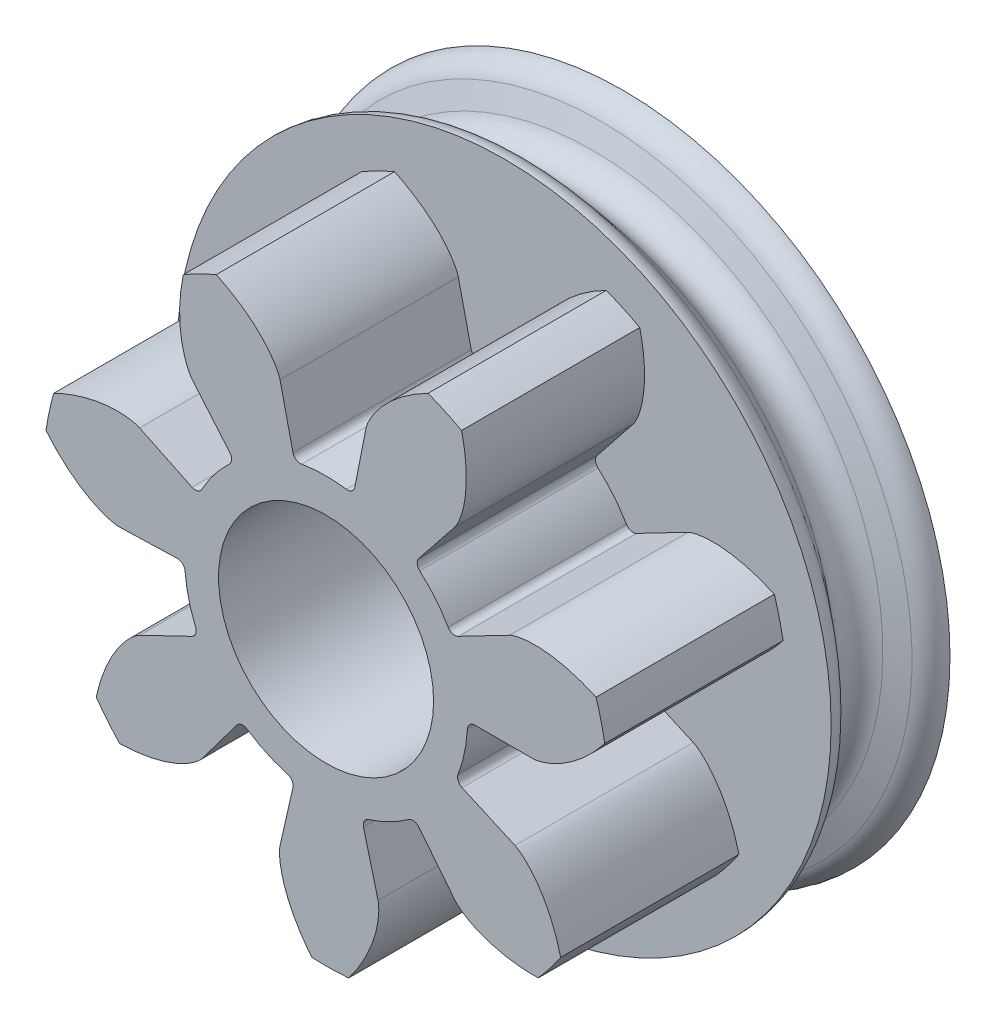
from build123d import *

# Parameters (mm, degrees)
SKETCH2_R                = 9.525
BOSS_EXTRUDE1_DEPTH      = 6
CUT_EXTRUDE1_DEPTH       = 6
FILLET1_R                = 0.254
CIRPATTERN3_COUNT        = 7
FILLET1_OF_CIRPATTERN3_R = 0.254
SKETCH5_R                = 3.6195
CUT_EXTRUDE2_DEPTH       = 19.493242128


# Read off the part's stored shape, not the designer's step: Cut-Extrude1
with BuildPart() as part:
    # Sketch2 → Boss-Extrude1 (new body)
    with BuildSketch(Plane.XY):
        Circle(SKETCH2_R)
    extrude(amount=BOSS_EXTRUDE1_DEPTH)

    # Cut-Extrude1 outline → Cut-Extrude1 (cut)
    with BuildSketch(Plane.XY):
        with BuildLine():
            add(Edge.make_bspline(
                [(7.897843079, -5.324443605), (7.889143341, -5.289999139), (7.867227424, -5.205648747), (7.827727113, -5.060059729), (7.771666127, -4.883663277), (7.701398596, -4.679948485), (7.625552695, -4.488360923), (7.541233, -4.294097512), (7.449800697, -4.106928499), (7.349957655, -3.921669386), (7.243971635, -3.745871788), (7.144005576, -3.596252965), (7.053247562, -3.472826422), (6.97418145, -3.373120571), (6.906540088, -3.293141366), (6.83627385, -3.215340389), (6.763281904, -3.140161429), (6.687469161, -3.067922243), (6.615142647, -3.004844734), (6.547015129, -2.950588631), (6.487230743, -2.907407915), (6.439655955, -2.876083449), (6.401232447, -2.853389362), (6.377134376, -2.840501757), (6.364085781, -2.83432127), (6.359383216, -2.832226927)],
                knots=[0.125661341, 0.125661341, 0.125661341, 0.125661341, 0.125661341, 0.164197228, 0.218929529, 0.273661934, 0.328394301, 0.383126635, 0.43785898, 0.492591256, 0.547323565, 0.602055884, 0.652783571, 0.680149903, 0.707515961, 0.734882063, 0.762248421, 0.789614741, 0.816980391, 0.844236067, 0.862480777, 0.880559096, 0.894007228, 0.903714168, 0.909090916, 0.909090916, 0.909090916, 0.909090916, 0.909090916], degree=4))
            ThreePointArc((7.897843079, -5.324443605), (9.316745812, -1.980876693), (9.380868546, 1.6507363))
            add(Edge.make_bspline(
                [(6.961556166, 0), (6.966704019, 0), (6.981138372, 0.000337209), (7.008395135, 0.002306025), (7.052727841, 0.007404928), (7.10893141, 0.016664594), (7.181112025, 0.031787617), (7.265419984, 0.053633703), (7.357152611, 0.081829835), (7.45579723, 0.116976829), (7.553061062, 0.155956916), (7.648901697, 0.198441138), (7.743230692, 0.24398307), (7.856021752, 0.302897275), (7.989143851, 0.378723625), (8.141333522, 0.474730445), (8.309672953, 0.592202432), (8.476250078, 0.720816713), (8.635921012, 0.854597498), (8.791980848, 0.997752698), (8.939211234, 1.141910972), (9.086279598, 1.299416968), (9.209256135, 1.437747419), (9.304570852, 1.554672786), (9.358908009, 1.622810658), (9.380868546, 1.6507363)],
                knots=[0, 0, 0, 0, 0, 0.005376748, 0.015083688, 0.02853182, 0.046610139, 0.064854849, 0.092110525, 0.119476175, 0.146842495, 0.174208853, 0.201574955, 0.228941013, 0.256307345, 0.307035032, 0.361767351, 0.41649966, 0.471231936, 0.525964281, 0.580696615, 0.635428982, 0.690161387, 0.744893688, 0.783429575, 0.783429575, 0.783429575, 0.783429575, 0.783429575], degree=4))
            Line((6.961556166, 0), (4.7625, 0))
            ThreePointArc((4.7625, 0), (4.658372906, -0.990438347), (4.350544885, -1.937566891))
            Line((4.350544885, -1.937566891), (6.359383216, -2.832226927))
        make_face()
    cut_extrude1 = extrude(amount=CUT_EXTRUDE1_DEPTH, mode=Mode.SUBTRACT)

    # Fillet1
    fillet1_edges = [part.edges().sort_by_distance(p)[0] for p in [
        (4.350544885, -1.937566891, 3),
        (4.7625, 0, 3),
    ]]
    fillet(fillet1_edges, radius=FILLET1_R)

    # CirPattern3: Cut-Extrude1 ×7 about axis
    cirpattern3_axis = Axis((0, 0, 55), (0, 0, -1))
    for i in range(1, CIRPATTERN3_COUNT):
        add(cut_extrude1.rotate(cirpattern3_axis, i * 360 / CIRPATTERN3_COUNT), mode=Mode.SUBTRACT)

    # Fillet1 of CirPattern3
    fillet1_of_cirpattern3_edges = [part.edges().sort_by_distance(p)[0] for p in [
        (1.197669574, -4.609446154, 3),
        (2.969370181, -3.723472435, 3),
        (-2.857075355, -3.810318447, 3),
        (-1.059755948, -4.643094182, 3),
        (-4.760384267, -0.141943234, 3),
        (-4.290864233, -2.066371308, 3),
        (-3.079026732, 3.63331813, 3),
        (-4.290864233, 2.066371308, 3),
        (0.920900733, 4.672616836, 3),
        (-1.059755948, 4.643094182, 3),
        (4.227371163, 2.19333976, 3),
        (2.969370181, 3.723472435, 3),
    ]]
    fillet(fillet1_of_cirpattern3_edges, radius=FILLET1_OF_CIRPATTERN3_R)

    # Sketch4 → Revolve1 (revolve)
    with BuildSketch(Plane(origin=(0, 0, 0), x_dir=(0, 0, -1), z_dir=(1, 0, 0))):
        with BuildLine():
            Line((0, 0), (0, 11))
            ThreePointArc((0, 11), (0.338094609, 10.92504623), (0.612835554, 10.714230088))
            Line((0.612835554, 10.714230088), (1.621351964, 9.512327033))
            ThreePointArc((1.621351964, 9.512327033), (2.373106061, 9.238710919), (2.985941615, 9.752941006))
            Line((2.985941615, 9.752941006), (3.248245903, 10.473616115))
            ThreePointArc((3.248245903, 10.473616115), (3.541138851, 10.855321635), (4, 11))
            Line((4, 11), (4, 0))
            Line((4, 0), (0, 0))
        make_face()
    revolve(axis=Axis((0, 0, -4), (0, 0, 1)))

    # Sketch5 → Cut-Extrude2 (cut, through all)
    with BuildSketch(Plane.XY.offset(6)):
        Circle(SKETCH5_R)
    extrude(amount=-CUT_EXTRUDE2_DEPTH, mode=Mode.SUBTRACT)


solid = part.part
